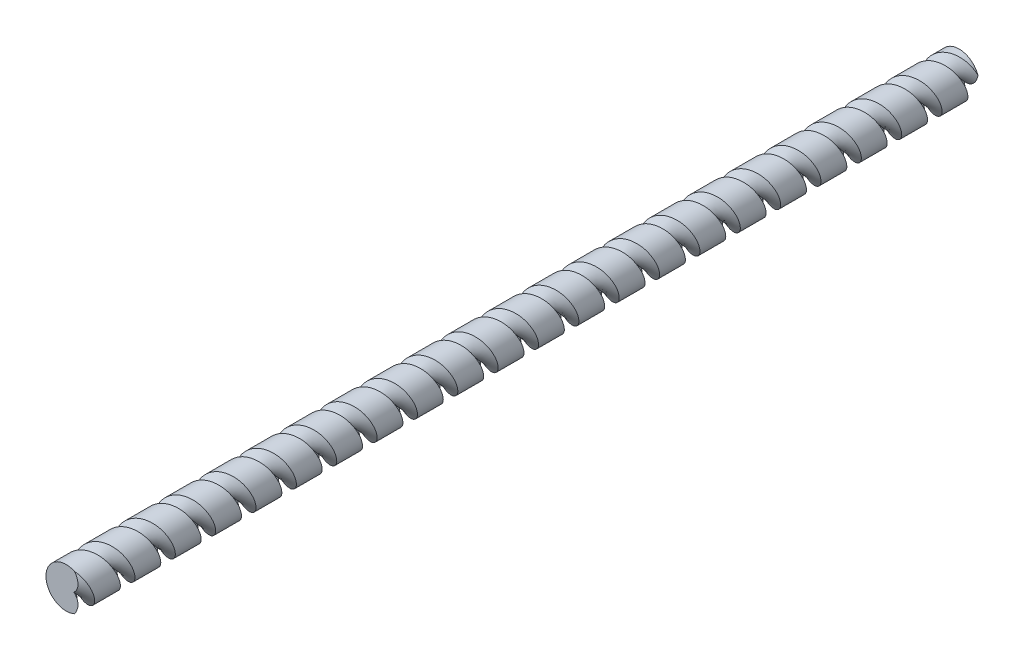
from build123d import *

# Parameters (mm, degrees)
CROQUIS1_R              = 4
SALIENTE_EXTRUIR1_DEPTH = 177
CORTAR_BARRER2_PITCH    = 8


with BuildPart() as part:
    # Croquis1 → Saliente-Extruir1 (new body)
    with BuildSketch(Plane.XY):
        Circle(CROQUIS1_R)
    extrude(amount=SALIENTE_EXTRUIR1_DEPTH)

    # Cortar-Barrer2: arcs per turn and ends read off the stored shape
    # Cortar-Barrer2: the profile of Croquis4 screwed along a right-hand helix through 61 turns, 8 arcs to a turn; built about Z, then put on its axis
    cortar_barrer2_z = Axis((0, 0, 0), (0, 0, 1))
    cortar_barrer2_corners = [(4, 0, -8), (4, 0, -6.556624327), (1.5, 0, -8), (4, 0, -9.443375673)]
    with BuildLine(mode=Mode.PRIVATE) as cortar_barrer2_profile:
        Line(cortar_barrer2_corners[0], cortar_barrer2_corners[1])
        Line(cortar_barrer2_corners[1], cortar_barrer2_corners[2])
        Line(cortar_barrer2_corners[2], cortar_barrer2_corners[3])
        Line(cortar_barrer2_corners[3], cortar_barrer2_corners[0])
    cortar_barrer2_cap = Face(cortar_barrer2_profile.wire())
    cortar_barrer2_turn_angles = [0, 22.5, 45, 67.5, 90, 112.5, 135, 157.5, 180, 202.5, 225, 247.5, 270, 292.5, 315, 337.5, 360]
    cortar_barrer2_turn_weights = [1, 0.9238795325112867, 1, 0.9238795325112867, 1, 0.9238795325112867, 1, 0.9238795325112867, 1, 0.9238795325112867, 1, 0.9238795325112867, 1, 0.9238795325112867, 1, 0.9238795325112867, 1]
    cortar_barrer2_turn_rails = [Edge.make_bspline([Vector(p[0], p[1], 0).rotate(cortar_barrer2_z, cortar_barrer2_turn_angles[k]) / cortar_barrer2_turn_weights[k] + Vector(0, 0, p[2] + CORTAR_BARRER2_PITCH * cortar_barrer2_turn_angles[k] / 360) for k in range(17)], [0, 0, 0, 1, 1, 2, 2, 3, 3, 4, 4, 5, 5, 6, 6, 7, 7, 8, 8, 8], 2, cortar_barrer2_turn_weights) for p in cortar_barrer2_corners]
    cortar_barrer2_turn_sides = [Face.make_surface_from_curves(cortar_barrer2_turn_rails[p[0]], cortar_barrer2_turn_rails[p[1]]) for p in [(0, 1), (1, 2), (2, 3), (3, 0)]]
    cortar_barrer2 = Plane(origin=(0, 0, 177), x_dir=(1, 0, 0), z_dir=(0, 0, -1)) * Solid(Shell([*[p.moved(Location((0, 0, CORTAR_BARRER2_PITCH * i))) for i in range(61) for p in cortar_barrer2_turn_sides], cortar_barrer2_cap, cortar_barrer2_cap.rotate(cortar_barrer2_z, 21960).moved(Location((0, 0, CORTAR_BARRER2_PITCH * 21960 / 360)))]))
    add(cortar_barrer2, mode=Mode.SUBTRACT)


solid = part.part
